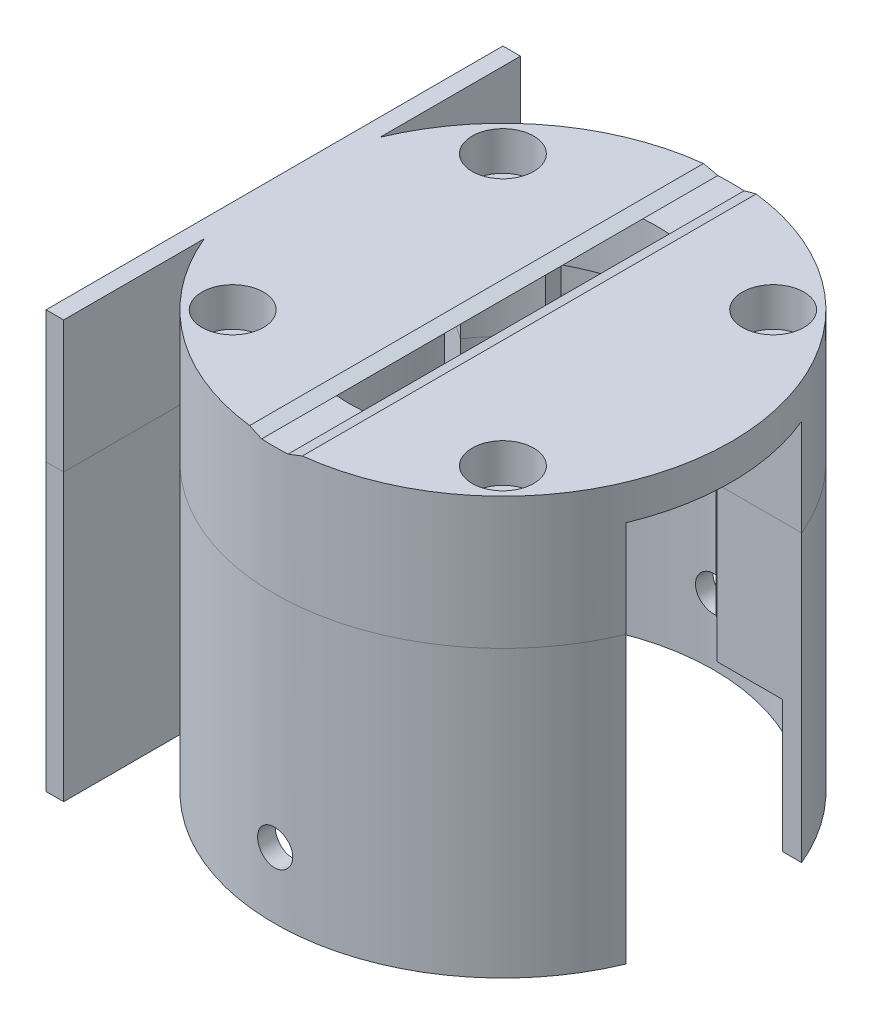
from build123d import *
from build123d.topology import SkipClean

# Parameters (mm, degrees)
SKETCH1_R                                           = 26
BOSS_EXTRUDE1_DEPTH                                 = 47
SKETCH2_R                                           = 17.5
CUT_EXTRUDE1_DEPTH                                  = 32
SKETCH3_R                                           = 24
CUT_EXTRUDE2_DEPTH                                  = 49.744230428
SKETCH11_W                                          = 20
SKETCH11_H                                          = 43.5
CUT_EXTRUDE3_DEPTH                                  = 15
SKETCH12_R                                          = 26
BOSS_EXTRUDE2_DEPTH                                 = 0.5
SKETCH26_W                                          = 2
SKETCH26_H                                          = 52
BOSS_EXTRUDE4_DEPTH                                 = 47.5
CIRPATTERN1_COUNT                                   = 4
CUT_EXTRUDE5_DEPTH                                  = 61.068710834
CUT_EXTRUDE5_DEPTH_BACK                             = 61.068710834
CBORE_FOR_M4_HEX_SOCKET_HEAD_CAP_SCREW2_D           = 4
CBORE_FOR_M4_HEX_SOCKET_HEAD_CAP_SCREW2_CBORE_D     = 7
CBORE_FOR_M4_HEX_SOCKET_HEAD_CAP_SCREW2_CBORE_DEPTH = 4.4
CIRPATTERN2_COUNT                                   = 4
CUT_EXTRUDE6_START                                  = -25
CUT_EXTRUDE6_DEPTH                                  = 25


with BuildPart() as part:
    # Sketch1 → Boss-Extrude1 (new body)
    with BuildSketch(Plane(origin=(0, 0, 0), x_dir=(1, 0, 0), z_dir=(0, 1, 0))):
        Circle(SKETCH1_R)
    extrude(amount=BOSS_EXTRUDE1_DEPTH)

    # Sketch2 → Cut-Extrude1 (cut)
    with BuildSketch(Plane(origin=(0, 47, 0), x_dir=(1, 0, 0), z_dir=(0, 1, 0))):
        Circle(SKETCH2_R)
    extrude(amount=-CUT_EXTRUDE1_DEPTH, mode=Mode.SUBTRACT)

    # Sketch3 → Cut-Extrude2 (cut, through all)
    with BuildSketch(Plane(origin=(0, 15, 0), x_dir=(1, 0, 0), z_dir=(0, 1, 0))):
        Circle(SKETCH3_R)
    extrude(amount=-CUT_EXTRUDE2_DEPTH, mode=Mode.SUBTRACT)

    # Sketch11 → Cut-Extrude3 (cut)
    with BuildSketch(Plane(origin=(26, 0, 0), x_dir=(0, 0, -1), z_dir=(1, 0, 0))):
        with Locations((0, 21.75)):
            Rectangle(SKETCH11_W, SKETCH11_H)
    extrude(amount=-CUT_EXTRUDE3_DEPTH, mode=Mode.SUBTRACT)

    # Sketch12 → Boss-Extrude2 (add)
    with BuildSketch(Plane(origin=(0, 47, 0), x_dir=(1, 0, 0), z_dir=(0, 1, 0))):
        Circle(SKETCH12_R)
    extrude(amount=BOSS_EXTRUDE2_DEPTH)

    # Sketch26 → Boss-Extrude4 (add)
    with BuildSketch(Plane.XZ):
        with Locations((-25, 0)):
            Rectangle(SKETCH26_W, SKETCH26_H)
    extrude(amount=-BOSS_EXTRUDE4_DEPTH)

    # Sketch5 → Ø4.0mm Dowel Hole1 (revolve, cut)
    with BuildSketch(Plane(origin=(26, 7.5, 0), x_dir=(0, 0, -1), z_dir=(0, 1, 0))):
        Polygon((0, 0), (0, 53.201721238), (2, 52), (2, 0), align=None)
    f_4_0mm_dowel_hole1 = revolve(axis=Axis((32.35, 7.5, 0), (-1, 0, 0)), mode=Mode.SUBTRACT)

    # CirPattern1: Ø4.0mm Dowel Hole1 ×4 about axis
    cirpattern1_axis = Axis((0, 0, 0), (0, 1, 0))
    for i in range(1, CIRPATTERN1_COUNT):
        add(f_4_0mm_dowel_hole1.rotate(cirpattern1_axis, i * 360 / CIRPATTERN1_COUNT), mode=Mode.SUBTRACT)

    # Sketch35 → Cut-Extrude5 (cut, two sides: drawn at the far end of the back side and taken through both)
    with BuildSketch(Plane.XY.offset(-CUT_EXTRUDE5_DEPTH_BACK)):
        Polygon((-3, 47.5), (3, 47.5), (1.5, 47), (-1.5, 47), align=None)
    extrude(amount=CUT_EXTRUDE5_DEPTH + CUT_EXTRUDE5_DEPTH_BACK, mode=Mode.SUBTRACT)

    # CBORE for M4 Hex Socket Head Cap Screw2 (through all)
    with Locations(Plane(origin=(0, 47.5, 0), x_dir=(1, 0, 0), z_dir=(0, 1, 0))):
        with Locations((-15.379572491, 15.379572491)):
            cbore_for_m4_hex_socket_head_cap_screw2 = CounterBoreHole(CBORE_FOR_M4_HEX_SOCKET_HEAD_CAP_SCREW2_D / 2, CBORE_FOR_M4_HEX_SOCKET_HEAD_CAP_SCREW2_CBORE_D / 2, CBORE_FOR_M4_HEX_SOCKET_HEAD_CAP_SCREW2_CBORE_DEPTH)

    # CirPattern2: CBORE for M4 Hex Socket Head Cap Screw2 ×4 about axis
    cirpattern2_axis = Axis((0, 47.5, 0), (0, 1, 0))
    for i in range(1, CIRPATTERN2_COUNT):
        add(cbore_for_m4_hex_socket_head_cap_screw2.rotate(cirpattern2_axis, i * 360 / CIRPATTERN2_COUNT), mode=Mode.SUBTRACT)

    # Sketch41 → Cut-Extrude6 (cut)
    with SkipClean():  # the faces are left unmerged after this step: merging them gives an invalid solid
        with BuildSketch(Plane.XZ.offset(-15).offset(CUT_EXTRUDE6_START)):
            with BuildLine():
                Line((-9.717729156, 14.553890891), (-13.327171414, 19.959621793))
                ThreePointArc((-13.327171414, 19.959621793), (1e-09, 24), (13.327171415, 19.959621792))
                Line((13.327171415, 19.959621792), (9.717729157, 14.55389089))
                ThreePointArc((9.717729157, 14.55389089), (1e-09, 17.5), (-9.717729156, 14.553890891))
            make_face()
            with BuildLine():
                Line((-9.717810502, -14.553836575), (-13.327282975, -19.959547302))
                ThreePointArc((-13.327282975, -19.959547302), (-6.7072e-05, -24), (13.327171414, -19.959621793))
                Line((13.327171414, -19.959621793), (9.717729156, -14.553890891))
                ThreePointArc((9.717729156, -14.553890891), (-4.8907e-05, -17.5), (-9.717810502, -14.553836575))
            make_face()
            with BuildLine():
                Line((-14.55389089, -9.717729157), (-19.959621792, -13.327171415))
                ThreePointArc((-19.959621792, -13.327171415), (-24, -1e-09), (-19.959621793, 13.327171414))
                Line((-19.959621793, 13.327171414), (-14.553890891, 9.717729156))
                ThreePointArc((-14.553890891, 9.717729156), (-17.5, -1e-09), (-14.55389089, -9.717729157))
            make_face()
        extrude(amount=CUT_EXTRUDE6_DEPTH, mode=Mode.SUBTRACT)


with BuildPart() as body_2:
    # Split2: the piece on the far side of the plane
    add(part.part)
    split(bisect_by=Plane.ZX.offset(32.5), keep=Keep.BOTTOM)


with BuildPart() as part_1:
    add(part.part)

    # Split2
    split(bisect_by=Plane.ZX.offset(32.5), keep=Keep.TOP)


solid = Compound([body_2.part, part_1.part])
